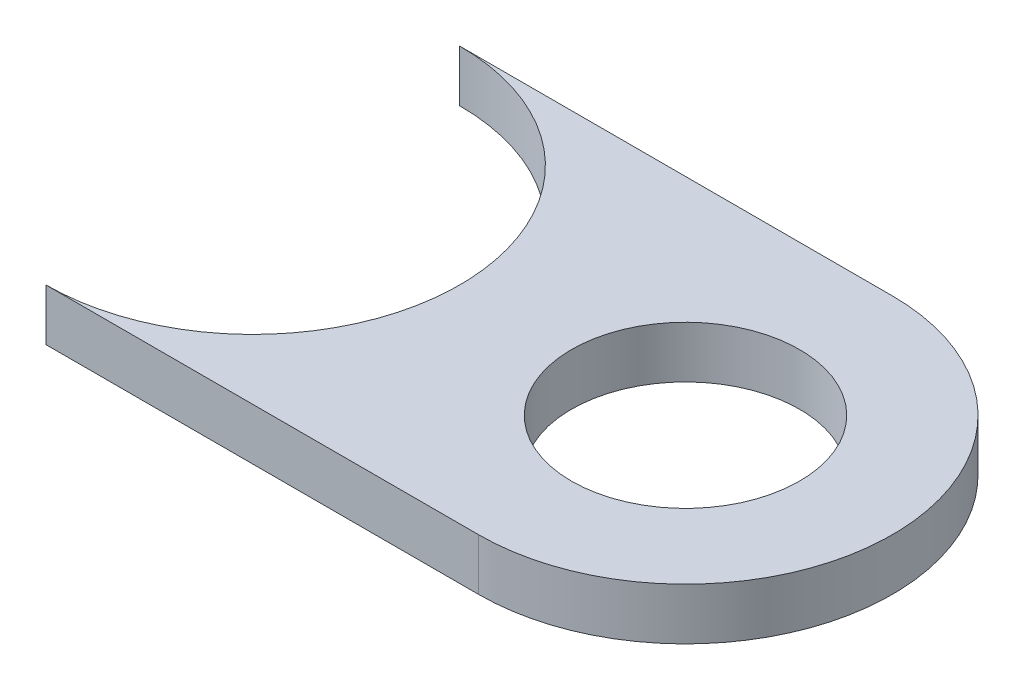
from build123d import *

# Parameters (mm, degrees)
SKETCH1_R           = 7.00024
BOSS_EXTRUDE1_DEPTH = 3.175


with BuildPart() as part:
    # Sketch1 → Boss-Extrude1 (new body)
    with BuildSketch(Plane(origin=(0, 0, 0), x_dir=(1, 0, 0), z_dir=(0, 1, 0))):
        with BuildLine():
            Line((-26.56078, 12.7), (0, 12.7))
            ThreePointArc((0, 12.7), (12.7, 0), (0, -12.7))
            Line((0, -12.7), (-26.56078, -12.7))
            ThreePointArc((-26.56078, -12.7), (-13.86078, 0), (-26.56078, 12.7))
        make_face()
        Circle(SKETCH1_R, mode=Mode.SUBTRACT)
    extrude(amount=BOSS_EXTRUDE1_DEPTH)


solid = part.part
